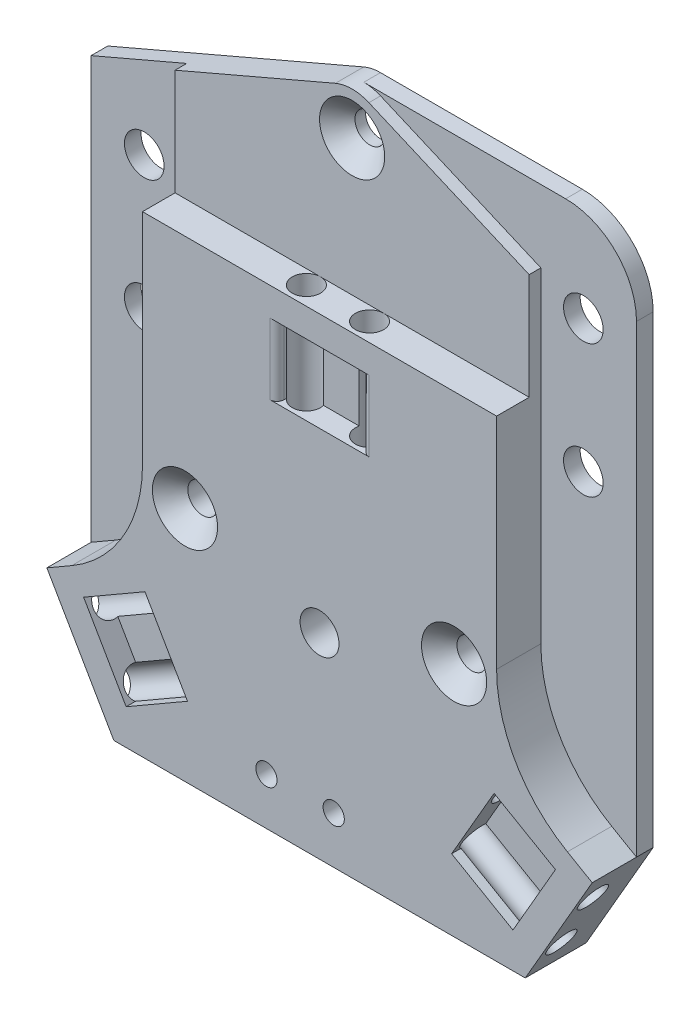
from build123d import *

# Parameters (mm, degrees)
BOSS_EXTRUDE1_DEPTH      = 2.6
BOSS_EXTRUDE1_DEPTH_BACK = 6
FILLET1_R                = 20
CUT_EXTRUDE1_DEPTH       = 5
SKETCH5_R                = 2
CUT_EXTRUDE2_DEPTH       = 20
FILLET3_R                = 1
CIRPATTERN1_COUNT        = 3
SKETCH6_R                = 2.75
CUT_EXTRUDE3_DEPTH       = 56.475677209
BOSS_EXTRUDE2_DEPTH      = 4
SKETCH8_R                = 2.1
CUT_EXTRUDE4_DEPTH       = 76.353770721
CHAMFER1_SIZE            = 2.5
SKETCH9_R                = 1.5
CUT_EXTRUDE5_DEPTH       = 76.353770721
BOSS_EXTRUDE3_START      = -2.35
BOSS_EXTRUDE3_DEPTH      = 2.35
BOSS_EXTRUDE4_DEPTH      = 2.35
SKETCH12_R               = 2.8
CUT_EXTRUDE6_DEPTH       = 2.35
FILLET4_R                = 10


with BuildPart() as part:
    # Sketch3 → Boss-Extrude1 (new, two sides: drawn at the far end of the back side and taken through both)
    with BuildSketch(Plane.XY.offset(-BOSS_EXTRUDE1_DEPTH_BACK)):
        Polygon((-25, 39), (25, 39), (25, -3.511595657), (38.504425224, -11.308379196), (33.774990748, -19.5), (29.045556271, -27.691620804), (-29.045556271, -27.691620804), (-33.774990748, -19.5), (-38.504425224, -11.308379196), (-25, -3.511595657), align=None)
    extrude(amount=BOSS_EXTRUDE1_DEPTH + BOSS_EXTRUDE1_DEPTH_BACK)

    # Fillet1
    fillet1_edges = [part.edges().sort_by_distance(p)[0] for p in [
        (-25, -3.511595657, -1.7),
        (25, -3.511595657, -1.7),
    ]]
    fillet(fillet1_edges, radius=FILLET1_R)

    # Sketch4 → Cut-Extrude1 (cut, symmetric)
    with BuildSketch(Plane(origin=(0, 30, 0), x_dir=(1, 0, 0), z_dir=(0, 1, 0))):
        Polygon((5.114783638, 0.485216362), (-5.114783638, 0.485216362), (-6, -0.4), (-6, -2.6), (6, -2.6), (6, -0.4), align=None)
    cut_extrude1 = extrude(amount=CUT_EXTRUDE1_DEPTH, both=True, mode=Mode.SUBTRACT)

    # Sketch5 → Cut-Extrude2 (cut)
    with BuildSketch(Plane(origin=(0, 39, 0), x_dir=(1, 0, 0), z_dir=(0, 1, 0))):
        with Locations((-4.458868953, 0)):
            Circle(SKETCH5_R)
        with Locations((4.458868953, 0)):
            Circle(SKETCH5_R)
    cut_extrude2 = extrude(amount=-CUT_EXTRUDE2_DEPTH, mode=Mode.SUBTRACT)

    # Fillet3
    fillet3_edges = [part.edges().sort_by_distance(p)[0] for p in [
        (-6, 30, 2.6),
        (6, 30, 2.6),
    ]]
    fillet(fillet3_edges, radius=FILLET3_R)

    # CirPattern1: Cut-Extrude1, Cut-Extrude2 ×3 about axis
    cirpattern1_axis = Axis((0, 0, -80.9), (0, 0, 1))
    add([cut_extrude1.rotate(cirpattern1_axis, i * 360 / CIRPATTERN1_COUNT) for i in range(1, CIRPATTERN1_COUNT)], mode=Mode.SUBTRACT)
    add([cut_extrude2.rotate(cirpattern1_axis, i * 360 / CIRPATTERN1_COUNT) for i in range(1, CIRPATTERN1_COUNT)], mode=Mode.SUBTRACT)

    # Sketch6 → Cut-Extrude3 (cut, through all)
    with BuildSketch(Plane.XY.offset(2.6)):
        Circle(SKETCH6_R)
    extrude(amount=-CUT_EXTRUDE3_DEPTH, mode=Mode.SUBTRACT)

    # Sketch7 → Boss-Extrude2 (add)
    with BuildSketch(Plane(origin=(0, 0, -6), x_dir=(-1, 0, 0), z_dir=(0, 0, -1))):
        with BuildLine():
            Line((-25, 39), (25, 39))
            Line((25, 39), (25, 54))
            Line((25, 54), (2.36629775, 63.713677082))
            ThreePointArc((2.36629775, 63.713677082), (0, 64.2), (-2.36629775, 63.713677082))
            Line((-2.36629775, 63.713677082), (-25, 54))
            Line((-25, 54), (-25, 39))
        make_face()
    extrude(amount=-BOSS_EXTRUDE2_DEPTH)

    # Sketch8 → Cut-Extrude4 (cut, through all)
    with BuildSketch(Plane.XY.offset(2.6)):
        with Locations((-19, 5.7)):
            Circle(SKETCH8_R)
        with Locations((19, 5.7)):
            Circle(SKETCH8_R)
        with Locations((0, 58.2)):
            Circle(SKETCH8_R)
    extrude(amount=-CUT_EXTRUDE4_DEPTH, mode=Mode.SUBTRACT)

    # Chamfer1
    chamfer1_edges = [part.edges().sort_by_distance(p)[0] for p in [
        (-21.1, 5.7, 2.6),
        (16.9, 5.7, 2.6),
        (-2.1, 58.2, -2),
    ]]
    chamfer(chamfer1_edges, length=CHAMFER1_SIZE)

    # Sketch9 → Cut-Extrude5 (cut, through all)
    with BuildSketch(Plane(origin=(0, 0, -6), x_dir=(-1, 0, 0), z_dir=(0, 0, -1))):
        with Locations((7.5, -21.041620804)):
            Circle(SKETCH9_R)
        with Locations((-2, -21.041620804)):
            Circle(SKETCH9_R)
    extrude(amount=-CUT_EXTRUDE5_DEPTH, mode=Mode.SUBTRACT)

    # Sketch10 → Boss-Extrude3 (add)
    with BuildSketch(Plane(origin=(0, 0, -6), x_dir=(-1, 0, 0), z_dir=(0, 0, -1)).offset(BOSS_EXTRUDE3_START)):
        with BuildLine():
            Line((25, 54), (38.504425224, 48.204323078))
            Line((38.504425224, 48.204323078), (38.504425224, -11.308379196))
            Line((38.504425224, -11.308379196), (35, -9.285098349))
            ThreePointArc((35, -9.285098349), (27.679491924, -1.964590274), (25, 8.035409726))
            Line((25, 8.035409726), (25, 54))
        make_face()
    extrude(amount=BOSS_EXTRUDE3_DEPTH)

    # Sketch11 → Boss-Extrude4 (add)
    with BuildSketch(Plane(origin=(0, 0, -6), x_dir=(-1, 0, 0), z_dir=(0, 0, -1))):
        with BuildLine():
            Line((-38.504425224, -11.308379196), (-38.504425224, 64.2))
            Line((-38.504425224, 64.2), (0, 64.2))
            ThreePointArc((0, 64.2), (-1.20787779, 64.077161836), (-2.36629775, 63.713677082))
            Line((-2.36629775, 63.713677082), (-25, 54))
            Line((-25, 54), (-25, 8.035409726))
            ThreePointArc((-25, 8.035409726), (-27.679491924, -1.964590274), (-35, -9.285098349))
            Line((-35, -9.285098349), (-38.504425224, -11.308379196))
        make_face()
    extrude(amount=-BOSS_EXTRUDE4_DEPTH)

    # Sketch12 → Cut-Extrude6 (cut)
    with BuildSketch(Plane.XY.offset(-3.65)):
        with Locations((-31, 39.8275)):
            Circle(SKETCH12_R)
        with Locations((31, 50.8275)):
            Circle(SKETCH12_R)
        with Locations((-31, 21.0775)):
            Circle(SKETCH12_R)
        with Locations((31, 32.0775)):
            Circle(SKETCH12_R)
    extrude(amount=-CUT_EXTRUDE6_DEPTH, mode=Mode.SUBTRACT)

    # Fillet4
    fillet4_edges = [part.edges().sort_by_distance(p)[0] for p in [
        (38.504425224, 64.2, -4.825),
    ]]
    fillet(fillet4_edges, radius=FILLET4_R)


solid = part.part
